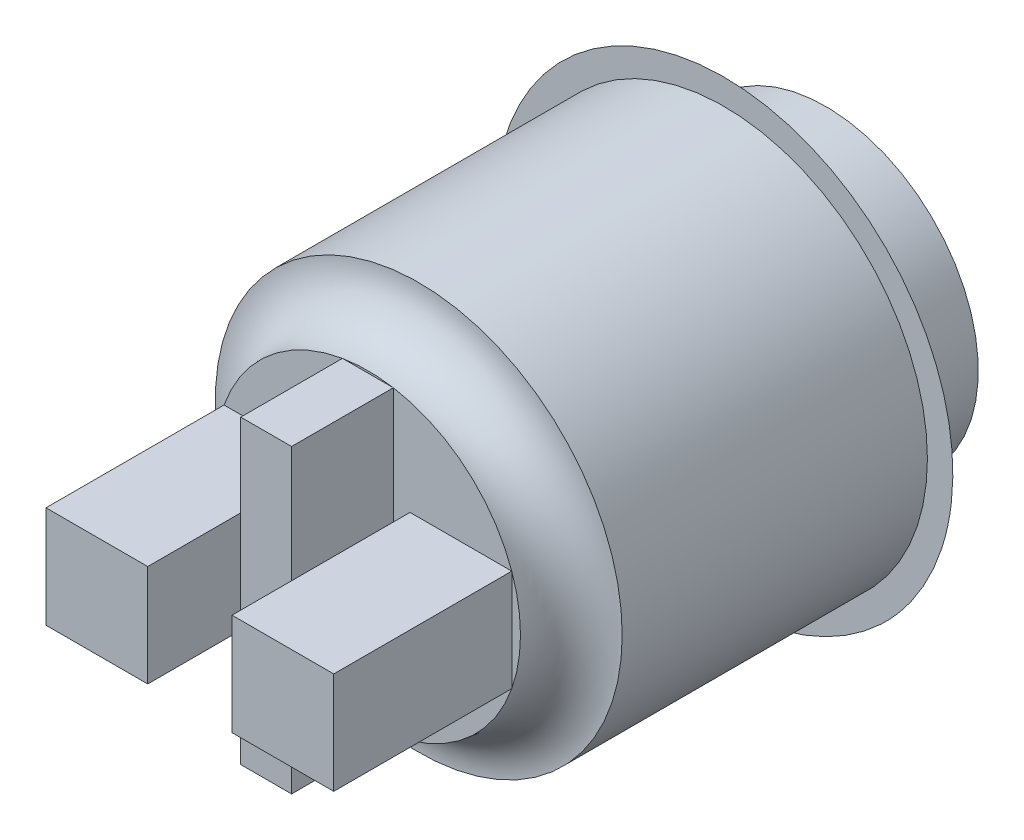
from build123d import *

# Parameters (mm, degrees)
SKETCH1_R           = 8
BOSS_EXTRUDE1_DEPTH = 12
SKETCH5_R           = 6
BOSS_EXTRUDE2_DEPTH = 2
BOSS_EXTRUDE3_START = 2
SKETCH6_R           = 6
BOSS_EXTRUDE3_DEPTH = 2
FILLET2_R           = 2
SKETCH7_W           = 4
SKETCH7_H           = 4
BOSS_EXTRUDE4_DEPTH = 7
SKETCH8_W           = 2
SKETCH8_H           = 11.832159566
BOSS_EXTRUDE5_DEPTH = 4


with BuildPart() as part:
    # Sketch1 → Boss-Extrude1 (new body)
    with BuildSketch(Plane.XY):
        Circle(SKETCH1_R)
    extrude(amount=BOSS_EXTRUDE1_DEPTH)

    # Loft1: read off the stored shape, not the designer's step
    # Loft1: loft between two sections, ruled curve by curve
    loft1_from = [
        Edge.make_bspline([(-5.955240995, 0.731508503, -2), (-7.418258001, -11.178973487, -2), (4.492223989, -12.641990493, -2), (5.955240995, -0.731508503, -2), (7.418258001, 11.178973487, -2), (-4.492223989, 12.641990493, -2), (-5.955240995, 0.731508503, -2)], [0, 0, 0, 0, 0.5, 0.5, 0.5, 1, 1, 1, 1], 3, [1, 0.333333333, 0.333333333, 1, 0.333333333, 0.333333333, 1]),
    ]
    loft1_to = [
        Edge.make_bspline([(-8.049637559, 4.025336653, 0), (-16.100310865, -12.073938465, 0), (-0.001035747, -20.124611771, 0), (8.049637559, -4.025336653, 0), (16.100310865, 12.073938465, 0), (0.001035747, 20.124611771, 0), (-8.049637559, 4.025336653, 0)], [0, 0, 0, 0, 0.5, 0.5, 0.5, 1, 1, 1, 1], 3, [1, 0.333333333, 0.333333333, 1, 0.333333333, 0.333333333, 1]),
    ]
    loft1 = Solid(Shell([*[Face.make_surface_from_curves(loft1_from[k], loft1_to[k]) for k in range(1)], Face(Wire(loft1_from)), Face(Wire(loft1_to))]))
    add(loft1)

    # Sketch5 → Boss-Extrude2 (add)
    with BuildSketch(Plane(origin=(0, 0, -2), x_dir=(-1, 0, 0), z_dir=(0, 0, -1))):
        with Locations(Location((0, 0, 0), (0, 0, 7.002813601))):
            Circle(SKETCH5_R)
    extrude(amount=BOSS_EXTRUDE2_DEPTH)

    # Sketch6 → Boss-Extrude3 (add)
    with BuildSketch(Plane.XY.offset(12).offset(BOSS_EXTRUDE3_START)):
        with Locations(Location((0, 0, 0), (0, 0, 172.997186399))):
            Circle(SKETCH6_R)
    extrude(amount=-BOSS_EXTRUDE3_DEPTH)

    # Fillet2
    fillet2_edges = [part.edges().sort_by_distance(p)[0] for p in [
        (5.955240995, -0.731508503, 12),
    ]]
    fillet(fillet2_edges, radius=FILLET2_R - 0.0001)  # a hair under: the kernel refuses the full size

    # Sketch7 → Boss-Extrude4 (add)
    with BuildSketch(Plane.XY.offset(14)):
        with Locations((-3.656854249, 0)):
            Rectangle(SKETCH7_W, SKETCH7_H)
        with Locations((3.656854249, 0)):
            Rectangle(SKETCH7_W, SKETCH7_H)
    extrude(amount=BOSS_EXTRUDE4_DEPTH)

    # Sketch8 → Boss-Extrude5 (add)
    with BuildSketch(Plane.XY.offset(14)):
        Rectangle(SKETCH8_W, SKETCH8_H)
    extrude(amount=BOSS_EXTRUDE5_DEPTH)


solid = part.part
